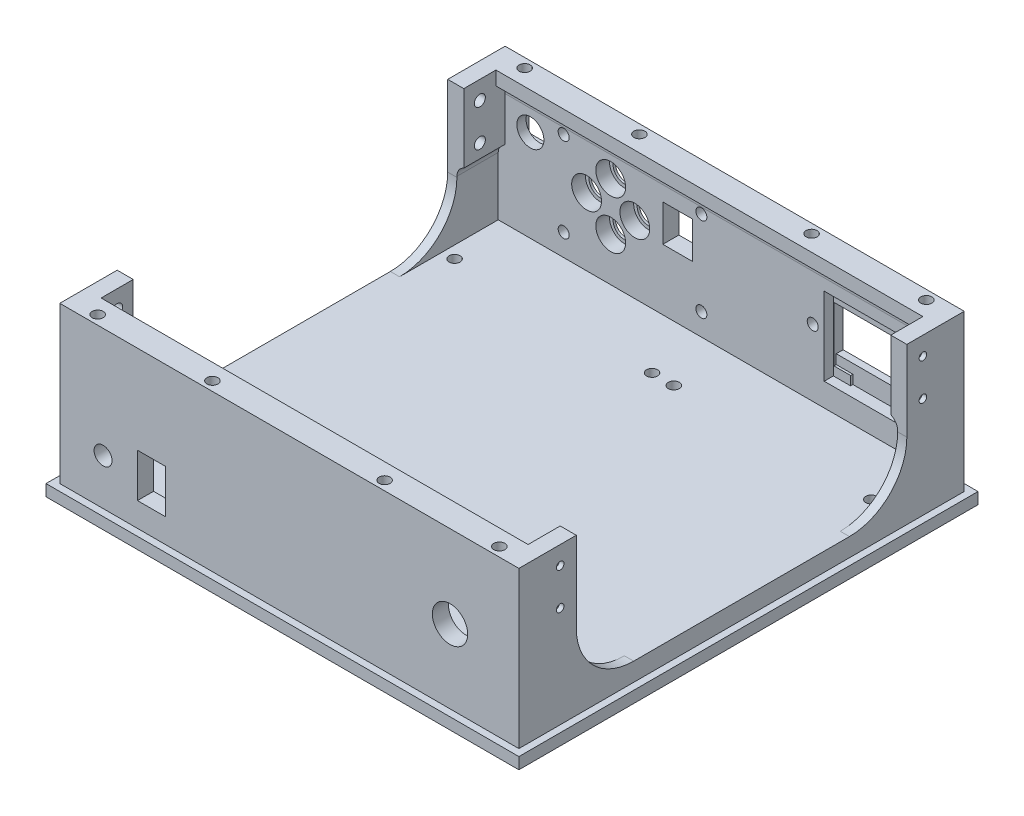
from build123d import *

# Parameters (mm, degrees)
SKETCH1_W           = 200
SKETCH1_H           = 194
BOSS_EXTRUDE1_DEPTH = 8
SKETCH4_R           = 2.4
CUT_EXTRUDE1_DEPTH  = 6
SKETCH5_W           = 200
SKETCH5_H           = 194
SKETCH5_W_2         = 192
SKETCH5_H_2         = 180
BOSS_EXTRUDE4_DEPTH = 60
SKETCH6_W           = 192
SKETCH6_H           = 6
BOSS_EXTRUDE5_DEPTH = 4
SKETCH7_R           = 2.4
CUT_EXTRUDE2_DEPTH  = 6
SKETCH10_R          = 3.9
SKETCH10_R_2        = 7.7
SKETCH10_W          = 12.3
SKETCH10_H          = 19
CUT_EXTRUDE4_DEPTH  = 10
SKETCH16_R          = 5
SKETCH16_R_2        = 5.9
SKETCH16_W          = 13
SKETCH16_H          = 16
CUT_EXTRUDE5_DEPTH  = 10
SKETCH17_W          = 15
SKETCH17_H          = 15
CUT_EXTRUDE6_DEPTH  = 3
SKETCH19_R          = 2.4
CUT_EXTRUDE7_DEPTH  = 5
SKETCH20_R          = 6.5
CUT_EXTRUDE8_DEPTH  = 6
SKETCH22_W          = 35
SKETCH22_H          = 34
CUT_EXTRUDE9_DEPTH  = 4
SKETCH23_W          = 34.5
SKETCH23_H          = 19.9
CUT_EXTRUDE10_DEPTH = 12
CUT_EXTRUDE11_DEPTH = 1
SKETCH25_R          = 2.4
CUT_EXTRUDE12_DEPTH = 5
SKETCH26_W          = 144
SKETCH26_H          = 60
CUT_EXTRUDE13_DEPTH = 287.810041665
SKETCH27_W          = 42.5
SKETCH27_H          = 27.9
SKETCH27_W_2        = 34.5
SKETCH27_H_2        = 19.9
BOSS_EXTRUDE7_DEPTH = 1
FILLET5_R           = 5
BOSS_EXTRUDE8_DEPTH = 3
FILLET6_R           = 5
SKETCH30_R          = 2.4
CUT_EXTRUDE14_DEPTH = 5
SKETCH32_R          = 1.65
CUT_EXTRUDE15_DEPTH = 15
FILLET7_R           = 5
FILLET8_R           = 5
FILLET9_R           = 5
FILLET10_R          = 25
SKETCH33_W          = 206
SKETCH33_H          = 200
BOSS_EXTRUDE9_DEPTH = 5


with BuildPart() as part:
    # Sketch1 → Boss-Extrude1 (new body)
    with BuildSketch(Plane(origin=(0, 0, 0), x_dir=(1, 0, 0), z_dir=(0, 1, 0))):
        with Locations((100, -97)):
            Rectangle(SKETCH1_W, SKETCH1_H)
    extrude(amount=BOSS_EXTRUDE1_DEPTH)

    # Sketch4 → Cut-Extrude1 (cut)
    with BuildSketch(Plane(origin=(0, 8, 0), x_dir=(1, 0, 0), z_dir=(0, 1, 0))):
        with Locations(Location((9.25, -31.25, 0), (0, 0, 270))):
            Circle(SKETCH4_R)
        with Locations(Location((95.25, -31.25, 0), (0, 0, 270))):
            Circle(SKETCH4_R)
        with Locations(Location((95.25, -162.75, 0), (0, 0, 90))):
            Circle(SKETCH4_R)
        with Locations(Location((9.25, -162.75, 0), (0, 0, 90))):
            Circle(SKETCH4_R)
        with Locations(Location((190.75, -162.75, 0), (0, 0, 270))):
            Circle(SKETCH4_R)
        with Locations(Location((104.75, -162.75, 0), (0, 0, 270))):
            Circle(SKETCH4_R)
        with Locations(Location((104.75, -31.25, 0), (0, 0, 90))):
            Circle(SKETCH4_R)
        with Locations(Location((190.75, -31.25, 0), (0, 0, 90))):
            Circle(SKETCH4_R)
    extrude(amount=-CUT_EXTRUDE1_DEPTH, mode=Mode.SUBTRACT)

    # Sketch5 → Boss-Extrude4 (add)
    with BuildSketch(Plane(origin=(0, 8, 0), x_dir=(1, 0, 0), z_dir=(0, 1, 0))):
        with Locations((100, -97)):
            Rectangle(SKETCH5_W, SKETCH5_H)
        with Locations((100, -97)):
            Rectangle(SKETCH5_W_2, SKETCH5_H_2, mode=Mode.SUBTRACT)
    extrude(amount=BOSS_EXTRUDE4_DEPTH)

    # Sketch6 → Boss-Extrude5 (add)
    with BuildSketch(Plane.XY.offset(7)):
        with Locations((100, 65)):
            Rectangle(SKETCH6_W, SKETCH6_H)
    boss_extrude5 = extrude(amount=BOSS_EXTRUDE5_DEPTH)

    # Sketch7 → Cut-Extrude2 (cut)
    with BuildSketch(Plane(origin=(0, 68, 0), x_dir=(1, 0, 0), z_dir=(0, 1, 0))):
        with Locations(Location((12.5, -4, 0), (0, 0, 270))):
            Circle(SKETCH7_R)
        with Locations(Location((62.5, -4, 0), (0, 0, 270))):
            Circle(SKETCH7_R)
        with Locations(Location((187.5, -4, 0), (0, 0, 270))):
            Circle(SKETCH7_R)
        with Locations(Location((137.5, -4, 0), (0, 0, 270))):
            Circle(SKETCH7_R)
    cut_extrude2 = extrude(amount=-CUT_EXTRUDE2_DEPTH, mode=Mode.SUBTRACT)

    # Mirror3: Boss-Extrude5 across plane
    add(boss_extrude5.mirror(Plane.XY.offset(97)))

    # Mirror5: Cut-Extrude2 across plane
    add(cut_extrude2.mirror(Plane.XY.offset(97)), mode=Mode.SUBTRACT)

    # Sketch10 → Cut-Extrude4 (cut)
    with BuildSketch(Plane.XY.offset(194)):
        with Locations((18.85, 20)):
            Circle(SKETCH10_R)
        with Locations((170, 32)):
            Circle(SKETCH10_R_2)
        with Locations((40, 20)):
            Rectangle(SKETCH10_W, SKETCH10_H)
    extrude(amount=-CUT_EXTRUDE4_DEPTH, mode=Mode.SUBTRACT)

    # Sketch16 → Cut-Extrude5 (cut)
    with BuildSketch(Plane(origin=(0, 0, 0), x_dir=(-1, 0, 0), z_dir=(0, 0, -1))):
        with Locations((-53, 48)):
            Circle(SKETCH16_R)
        with Locations((-63.5, 37.5)):
            Circle(SKETCH16_R)
        with Locations((-42.5, 37.5)):
            Circle(SKETCH16_R)
        with Locations((-53, 27)):
            Circle(SKETCH16_R)
        with Locations((-18, 48)):
            Circle(SKETCH16_R_2)
        with Locations((-82.2, 42.6)):
            Rectangle(SKETCH16_W, SKETCH16_H)
    extrude(amount=-CUT_EXTRUDE5_DEPTH, mode=Mode.SUBTRACT)

    # Sketch17 → Cut-Extrude6 (cut)
    with BuildSketch(Plane(origin=(0, 0, 0), x_dir=(-1, 0, 0), z_dir=(0, 0, -1))):
        with Locations((-18, 48)):
            Rectangle(SKETCH17_W, SKETCH17_H)
    extrude(amount=-CUT_EXTRUDE6_DEPTH, mode=Mode.SUBTRACT)

    # Sketch19 → Cut-Extrude7 (cut)
    with BuildSketch(Plane.XY.offset(7)):
        with Locations((32.5, 54.4)):
            Circle(SKETCH19_R)
        with Locations((92.5, 54.4)):
            Circle(SKETCH19_R)
        with Locations((92.5, 17.6)):
            Circle(SKETCH19_R)
        with Locations((32.5, 17.6)):
            Circle(SKETCH19_R)
    extrude(amount=-CUT_EXTRUDE7_DEPTH, mode=Mode.SUBTRACT)

    # Sketch20 → Cut-Extrude8 (cut)
    with BuildSketch(Plane.XY.offset(7)):
        with Locations((53, 48)):
            Circle(SKETCH20_R)
        with Locations((42.5, 37.5)):
            Circle(SKETCH20_R)
        with Locations((53, 27)):
            Circle(SKETCH20_R)
        with Locations((63.5, 37.5)):
            Circle(SKETCH20_R)
    extrude(amount=-CUT_EXTRUDE8_DEPTH, mode=Mode.SUBTRACT)

    # Sketch22 → Cut-Extrude9 (cut)
    with BuildSketch(Plane.XY.offset(7)):
        with Locations((163.5, 35.101020514)):
            Rectangle(SKETCH22_W, SKETCH22_H)
    extrude(amount=-CUT_EXTRUDE9_DEPTH, mode=Mode.SUBTRACT)

    # Sketch23 → Cut-Extrude10 (cut)
    with BuildSketch(Plane.XY.offset(3)):
        with Locations((163.5, 36.051020514)):
            Rectangle(SKETCH23_W, SKETCH23_H)
    extrude(amount=-CUT_EXTRUDE10_DEPTH, mode=Mode.SUBTRACT)

    # Sketch24 → Cut-Extrude11 (cut)
    with BuildSketch(Plane.XY.offset(3)):
        Polygon((146.25, 26.101020514), (146.25, 22.001020514), (153.5, 22.001020514), (153.5, 18.101020514), (173.5, 18.101020514), (173.5, 22.001020514), (180.75, 22.001020514), (180.75, 26.101020514), align=None)
    extrude(amount=-CUT_EXTRUDE11_DEPTH, mode=Mode.SUBTRACT)

    # Sketch25 → Cut-Extrude12 (cut)
    with BuildSketch(Plane.XY.offset(7)):
        with Locations((141, 37.101020514)):
            Circle(SKETCH25_R)
        with Locations((186, 37.101020514)):
            Circle(SKETCH25_R)
    extrude(amount=-CUT_EXTRUDE12_DEPTH, mode=Mode.SUBTRACT)

    # Sketch26 → Cut-Extrude13 (cut, through all)
    with BuildSketch(Plane.ZY):
        with Locations((97, 38)):
            Rectangle(SKETCH26_W, SKETCH26_H)
    extrude(amount=-CUT_EXTRUDE13_DEPTH, mode=Mode.SUBTRACT)

    # Sketch27 → Boss-Extrude7 (add)
    with BuildSketch(Plane(origin=(0, 0, 0), x_dir=(-1, 0, 0), z_dir=(0, 0, -1))):
        with Locations((-163.5, 36.051020514)):
            Rectangle(SKETCH27_W, SKETCH27_H)
        with Locations((-163.5, 36.051020514)):
            Rectangle(SKETCH27_W_2, SKETCH27_H_2, mode=Mode.SUBTRACT)
    extrude(amount=BOSS_EXTRUDE7_DEPTH)

    # Fillet5
    fillet5_edges = [part.edges().sort_by_distance(p)[0] for p in [
        (184.75, 50.001020514, -0.5),
        (184.75, 22.101020514, -0.5),
        (142.25, 22.101020514, -0.5),
        (142.25, 50.001020514, -0.5),
    ]]
    fillet(fillet5_edges, radius=FILLET5_R)

    # Sketch28 → Boss-Extrude8 (add)
    with BuildSketch(Plane.ZY.offset(-196)):
        Polygon((25, 68), (11, 68), (11, 62), (7, 62), (7, 38), (11, 38), (25, 38), align=None)
        Polygon((183, 68), (169, 68), (169, 38), (183, 38), (187, 38), (187, 62), (183, 62), align=None)
    boss_extrude8 = extrude(amount=BOSS_EXTRUDE8_DEPTH)

    # Fillet6
    # the kernel refuses this fillet: 5 mm, written as the material it adds along each edge
    with BuildSketch(Plane(origin=(196, 38, 169), x_dir=(-1, 0, 0), z_dir=(0, 0, 1)), Plane(origin=(196, 38, 7), x_dir=(-1, 0, 0), z_dir=(0, 0, 1))) as fillet6_piece_1:
        with BuildLine():
            CenterArc((5, 4.582575695), FILLET6_R, 180, 66.421821522)
            Line((0, 4.582575695), (0, 0))
            Line((0, 0), (3, 0))
        make_face()
    extrude(amount=18)

    # Sketch30 → Cut-Extrude14 (cut)
    with BuildSketch(Plane.ZY.offset(-193)):
        with Locations((18, 60)):
            Circle(SKETCH30_R)
        with Locations((18, 44)):
            Circle(SKETCH30_R)
        with Locations(Location((176, 44, 0), (0, 0, 180))):
            Circle(SKETCH30_R)
        with Locations(Location((176, 60, 0), (0, 0, 180))):
            Circle(SKETCH30_R)
    cut_extrude14 = extrude(amount=-CUT_EXTRUDE14_DEPTH, mode=Mode.SUBTRACT)

    # Sketch32 → Cut-Extrude15 (cut)
    with BuildSketch(Plane.ZY.offset(-198)):
        with Locations((18, 60)):
            Circle(SKETCH32_R)
        with Locations((18, 44)):
            Circle(SKETCH32_R)
        with Locations((176, 44)):
            Circle(SKETCH32_R)
        with Locations((176, 60)):
            Circle(SKETCH32_R)
    cut_extrude15 = extrude(amount=-CUT_EXTRUDE15_DEPTH, mode=Mode.SUBTRACT)

    # Mirror8: Boss-Extrude8, Cut-Extrude14, Cut-Extrude15 across plane
    add(boss_extrude8.mirror(Plane(origin=(100, 0, 0), x_dir=(0, 0, 1), z_dir=(1, 0, 0))))
    add(cut_extrude14.mirror(Plane(origin=(100, 0, 0), x_dir=(0, 0, 1), z_dir=(1, 0, 0))), mode=Mode.SUBTRACT)
    add(cut_extrude15.mirror(Plane(origin=(100, 0, 0), x_dir=(0, 0, 1), z_dir=(1, 0, 0))), mode=Mode.SUBTRACT)

    # Fillet7
    # the kernel refuses this fillet: 5 mm, written as the material it adds along each edge
    with BuildSketch(Plane(origin=(4, 38, 169), x_dir=(0, -1, 0), z_dir=(0, 0, 1))) as fillet7_piece_1_section:
        with BuildLine():
            CenterArc((4.582575695, 5), FILLET7_R, 203.578178478, 66.421821522)
            Line((0, 3), (0, 0))
            Line((0, 0), (4.582575695, 0))
        make_face()
    fillet7_piece_1 = extrude(amount=29.456439237, mode=Mode.PRIVATE)
    fillet7_piece_1 = split(fillet7_piece_1, bisect_by=Plane(origin=(4.808333267, 36.161514318, 194), z_dir=(0, 0, -1)), keep=Keep.TOP, mode=Mode.PRIVATE)
    add(fillet7_piece_1)
    with BuildSketch(Plane(origin=(4, 38, -4.456439237), x_dir=(0, -1, 0), z_dir=(0, 0, 1))) as fillet7_piece_2_section:
        with BuildLine():
            CenterArc((4.582575695, 5), FILLET7_R, 203.578178478, 66.421821522)
            Line((0, 3), (0, 0))
            Line((0, 0), (4.582575695, 0))
        make_face()
    fillet7_piece_2 = extrude(amount=29.456439237, mode=Mode.PRIVATE)
    fillet7_piece_2 = split(fillet7_piece_2, bisect_by=Plane(origin=(4.808333267, 36.161514318, 0), z_dir=(0, 0, 1)), keep=Keep.TOP, mode=Mode.PRIVATE)
    add(fillet7_piece_2)

    # Fillet8
    # the kernel refuses this fillet: 5 mm, written as the material it adds along each edge
    with BuildSketch(Plane(origin=(7, 62, 7), x_dir=(0, -1, 0), z_dir=(1, 0, 0))) as fillet8_piece_1:
        with BuildLine():
            CenterArc((4.898979486, -5), FILLET8_R, 90, 78.463040967)
            Line((0, -4), (0, 0))
            Line((0, 0), (4.898979486, 0))
        make_face()
    extrude(amount=186)

    # Fillet9
    # the kernel refuses this fillet: 5 mm, written as the material it adds along each edge
    with BuildSketch(Plane(origin=(7, 62, 187), x_dir=(0, -1, 0), z_dir=(1, 0, 0))) as fillet9_piece_1:
        with BuildLine():
            CenterArc((4.898979486, 5), FILLET9_R, 191.536959033, 78.463040967)
            Line((0, 4), (0, 0))
            Line((0, 0), (4.898979486, 0))
        make_face()
    extrude(amount=186)

    # Fillet10
    fillet10_edges = [part.edges().sort_by_distance(p)[0] for p in [
        (198, 8, 25),
        (198, 8, 169),
        (2, 8, 169),
        (2, 8, 25),
    ]]
    fillet(fillet10_edges, radius=FILLET10_R)

    # Sketch33 → Boss-Extrude9 (add)
    with BuildSketch(Plane.XZ):
        with Locations((100, 97)):
            Rectangle(SKETCH33_W, SKETCH33_H)
    extrude(amount=BOSS_EXTRUDE9_DEPTH)


solid = part.part
